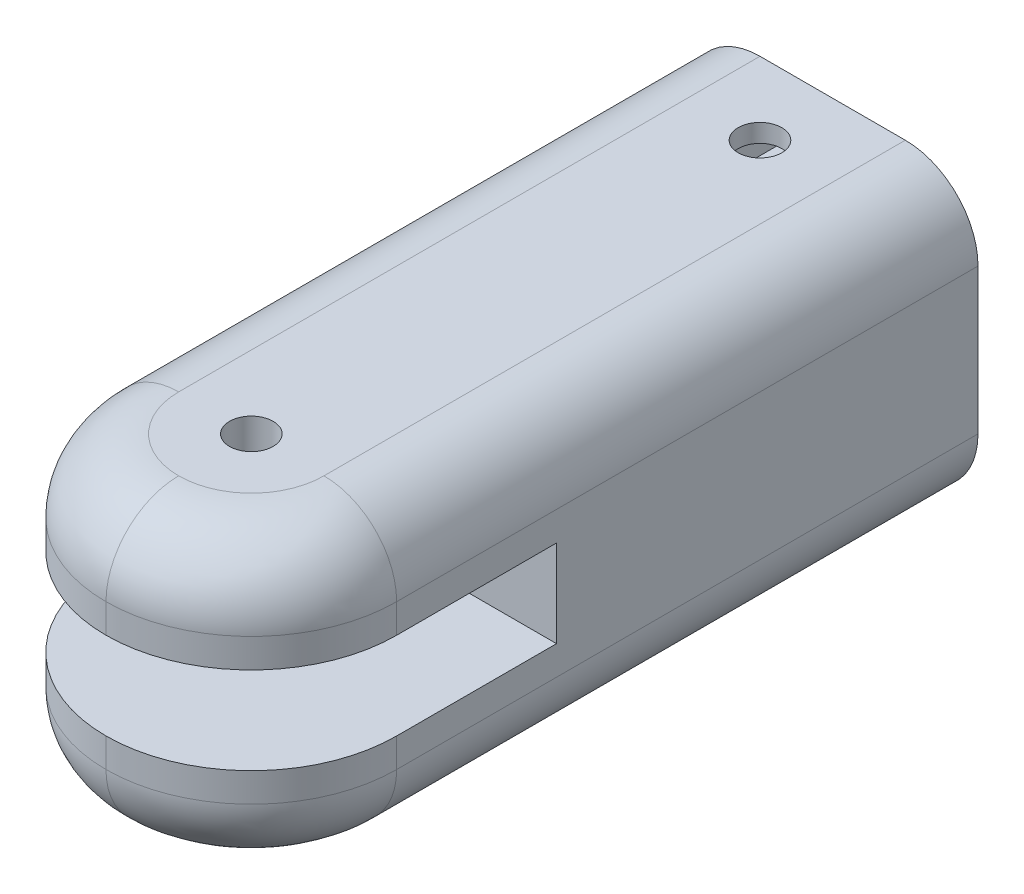
from build123d import *

# Parameters (mm, degrees)
SKETCH1_W           = 20
SKETCH1_H           = 20
SKETCH1_R           = 5.3
BOSS_EXTRUDE1_DEPTH = 25
SKETCH2_W           = 20
SKETCH2_H           = 20
BOSS_EXTRUDE2_DEPTH = 25
SKETCH4_W           = 20
SKETCH4_H           = 6
CUT_EXTRUDE1_DEPTH  = 21
CUT_EXTRUDE2_REACH  = 59.446
SKETCH5_R           = 1.5
FILLET2_R           = 10
FILLET3_R           = 5
SKETCH6_W           = 5.65
SKETCH6_H           = 2.5
CUT_EXTRUDE3_DEPTH  = 8
CHAMFER1_SIZE       = 1


with BuildPart() as part:
    # Sketch1 → Boss-Extrude1 (new body)
    with BuildSketch(Plane.XY):
        with Locations((10, 10)):
            Rectangle(SKETCH1_W, SKETCH1_H)
        with Locations((10, 10)):
            Circle(SKETCH1_R, mode=Mode.SUBTRACT)
    extrude(amount=BOSS_EXTRUDE1_DEPTH)

    # Sketch2 → Boss-Extrude2 (add)
    with BuildSketch(Plane.XY.offset(25)):
        with Locations((10, 10)):
            Rectangle(SKETCH2_W, SKETCH2_H)
    extrude(amount=BOSS_EXTRUDE2_DEPTH)

    # Sketch4 → Cut-Extrude1 (cut)
    with BuildSketch(Plane.XY.offset(50)):
        with Locations((10, 10)):
            Rectangle(SKETCH4_W, SKETCH4_H)
    extrude(amount=-CUT_EXTRUDE1_DEPTH, mode=Mode.SUBTRACT)

    # Cut-Extrude2: up to this face of the body (flat: up to its plane)
    cut_extrude2_end = Plane(part.part.faces().sort_by_distance((10, 0, 25))[0])
    # Sketch5 → Cut-Extrude2 (cut, up to the picked face)
    with BuildSketch(Plane(origin=(0, 20, 0), x_dir=(1, 0, 0), z_dir=(0, 1, 0)), mode=Mode.PRIVATE) as cut_extrude2_sk1:
        with Locations(Location((10, -5, 0), (0, 0, 270))):
            Circle(SKETCH5_R)
    cut_extrude2_tool1 = split(extrude(cut_extrude2_sk1.sketch, amount=-CUT_EXTRUDE2_REACH, mode=Mode.PRIVATE), bisect_by=cut_extrude2_end, keep=Keep.BOTH, mode=Mode.PRIVATE)
    # Sketch5 → Cut-Extrude2 (cut, up to the picked face)
    with BuildSketch(Plane(origin=(0, 20, 0), x_dir=(1, 0, 0), z_dir=(0, 1, 0)), mode=Mode.PRIVATE) as cut_extrude2_sk2:
        with Locations(Location((10, -40, 0), (0, 0, 270))):
            Circle(SKETCH5_R)
    cut_extrude2_tool2 = split(extrude(cut_extrude2_sk2.sketch, amount=-CUT_EXTRUDE2_REACH, mode=Mode.PRIVATE), bisect_by=cut_extrude2_end, keep=Keep.BOTH, mode=Mode.PRIVATE)
    add(cut_extrude2_tool1.solids().sort_by(Axis((10, 20, 5), (0, -1, 0)))[0], mode=Mode.SUBTRACT)
    add(cut_extrude2_tool2.solids().sort_by(Axis((10, 20, 40), (0, -1, 0)))[0], mode=Mode.SUBTRACT)

    # Fillet2
    fillet2_edges = [part.edges().sort_by_distance(p)[0] for p in [
        (0, 16.5, 50),
        (0, 3.5, 50),
        (20, 3.5, 50),
        (20, 16.5, 50),
    ]]
    fillet(fillet2_edges, radius=FILLET2_R - 0.0001)  # a hair under: the kernel refuses the full size

    # Fillet3
    fillet3_edges = [part.edges().sort_by_distance(p)[0] for p in [
        (0, 20, 20.00005),
        (0, 0, 20.00005),
        (20, 20, 20.00005),
        (17.071097101, 20, 47.071097101),
        (2.928902899, 20, 47.071097101),
        (20, 0, 20.00005),
        (17.071097101, 0, 47.071097101),
        (2.928902899, 0, 47.071097101),
    ]]
    fillet(fillet3_edges, radius=FILLET3_R)

    # Sketch6 → Cut-Extrude3 (cut)
    with BuildSketch(Plane(origin=(0, 0, 0), x_dir=(-1, 0, 0), z_dir=(0, 0, -1))):
        with Locations((-10, 17.5)):
            Rectangle(SKETCH6_W, SKETCH6_H)
        with Locations((-10, 2.5)):
            Rectangle(SKETCH6_W, SKETCH6_H)
    extrude(amount=-CUT_EXTRUDE3_DEPTH, mode=Mode.SUBTRACT)

    # Chamfer1
    chamfer1_edges = [part.edges().sort_by_distance(p)[0] for p in [
        (12.825, 17.5, 8),
        (7.175, 17.5, 8),
        (12.825, 2.5, 8),
        (7.175, 2.5, 8),
    ]]
    chamfer(chamfer1_edges, length=CHAMFER1_SIZE)


solid = part.part
